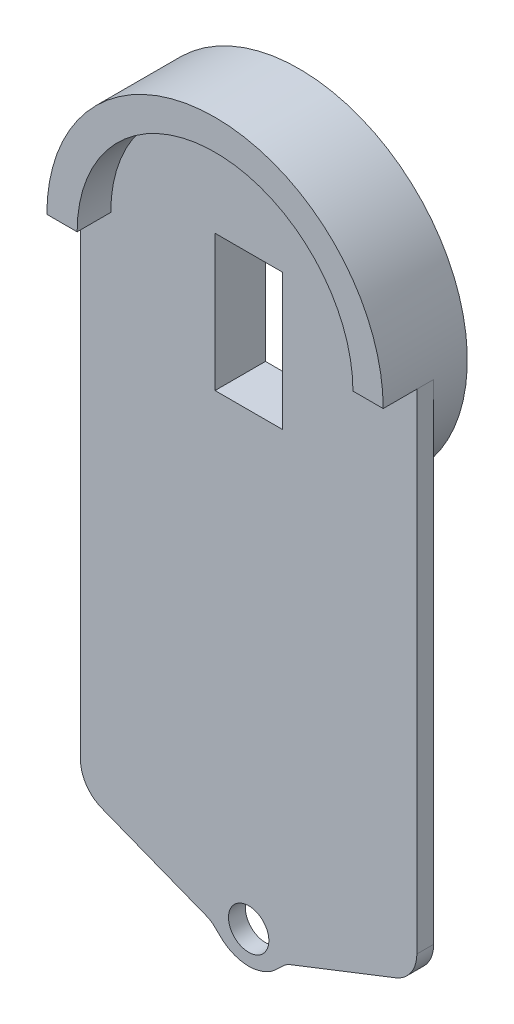
from build123d import *

# Parameters (mm, degrees)
CROQUIS1_R              = 6
SALIENTE_EXTRUIR1_DEPTH = 5
REDONDEO1_R             = 10
REDONDEO3_R             = 10
CROQUIS2_R              = 50
CROQUIS2_R_2            = 41
SALIENTE_EXTRUIR3_DEPTH = 10
CROQUIS3_W              = 20
CROQUIS3_H              = 40.5
CORTAR_EXTRUIR1_DEPTH   = 10
CORTAR_EXTRUIR2_START   = -10
CORTAR_EXTRUIR2_DEPTH   = 10
SALIENTE_EXTRUIR4_START = 10
CROQUIS5_R              = 50
SALIENTE_EXTRUIR4_DEPTH = 10


with BuildPart() as part:
    # Croquis1 → Saliente-Extruir1 (new body)
    with BuildSketch(Plane.XY):
        with BuildLine():
            ThreePointArc((50, 164), (0, 214), (-50, 164))
            Line((-50, 164), (-50, 11.739233328))
            Line((-50, 11.739233328), (-20, 0))
            Line((-20, 0), (-13.787308542, -2.431074487))
            add(Edge.make_bspline(
                [(-8.854817181, -5.677302066), (-9.51760475, -5.090344722), (-10.900654261, -3.469047842), (-12.711160318, -2.852179657), (-13.787308542, -2.431074487)],
                knots=[0.517708821, 0.517708821, 0.517708821, 0.517708821, 0.741171884, 1, 1, 1, 1], degree=3))
            ThreePointArc((-8.854817181, -5.677302066), (0, -9.578400122), (8.854817181, -5.677302066))
            add(Edge.make_bspline(
                [(8.854817181, -5.677302066), (9.51760475, -5.090344722), (10.900654261, -3.469047842), (12.711160318, -2.852179657), (13.787308542, -2.431074487)],
                knots=[0.517708821, 0.517708821, 0.517708821, 0.517708821, 0.741171884, 1, 1, 1, 1], degree=3))
            Line((13.787308542, -2.431074487), (20, 0))
            Line((20, 0), (50, 11.739233328))
            Line((50, 11.739233328), (50, 164))
        make_face()
        Circle(CROQUIS1_R, mode=Mode.SUBTRACT)
    extrude(amount=SALIENTE_EXTRUIR1_DEPTH)

    # Redondeo1
    redondeo1_edges = [part.edges().sort_by_distance(p)[0] for p in [
        (50, 11.739233328, 2.5),
    ]]
    fillet(redondeo1_edges, radius=REDONDEO1_R)

    # Redondeo3
    redondeo3_edges = [part.edges().sort_by_distance(p)[0] for p in [
        (-50, 11.739233328, 2.5),
    ]]
    fillet(redondeo3_edges, radius=REDONDEO3_R)

    # Croquis2 → Saliente-Extruir3 (add)
    with BuildSketch(Plane.XY.offset(5)):
        with Locations((0, 164)):
            Circle(CROQUIS2_R)
        with Locations((0, 164)):
            Circle(CROQUIS2_R_2, mode=Mode.SUBTRACT)
    extrude(amount=SALIENTE_EXTRUIR3_DEPTH)

    # Croquis3 → Cortar-Extruir1 (cut)
    with BuildSketch(Plane(origin=(0, 0, 0), x_dir=(-1, 0, 0), z_dir=(0, 0, -1))):
        with Locations((0, 153.891101056)):
            Rectangle(CROQUIS3_W, CROQUIS3_H)
    extrude(amount=-CORTAR_EXTRUIR1_DEPTH, mode=Mode.SUBTRACT)

    # Croquis4 → Cortar-Extruir2 (cut)
    with BuildSketch(Plane.XY.offset(15).offset(CORTAR_EXTRUIR2_START)):
        with BuildLine():
            Line((-41, 164), (-50, 164))
            ThreePointArc((-50, 164), (0, 114), (50, 164))
            Line((50, 164), (41, 164))
            ThreePointArc((41, 164), (0, 123), (-41, 164))
        make_face()
    extrude(amount=CORTAR_EXTRUIR2_DEPTH, mode=Mode.SUBTRACT)

    # Croquis5 → Saliente-Extruir4 (add)
    with BuildSketch(Plane(origin=(0, 0, 0), x_dir=(-1, 0, 0), z_dir=(0, 0, -1)).offset(SALIENTE_EXTRUIR4_START)):
        with Locations((0, 164)):
            Circle(CROQUIS5_R)
        Polygon((-10, 174.141101056), (-8, 174.141101056), (-8, 194.141101056), (8, 194.141101056), (8, 174.141101056), (10, 174.141101056), (10, 133.641101056), (-10, 133.641101056), align=None, mode=Mode.SUBTRACT)
    extrude(amount=-SALIENTE_EXTRUIR4_DEPTH)


solid = part.part
